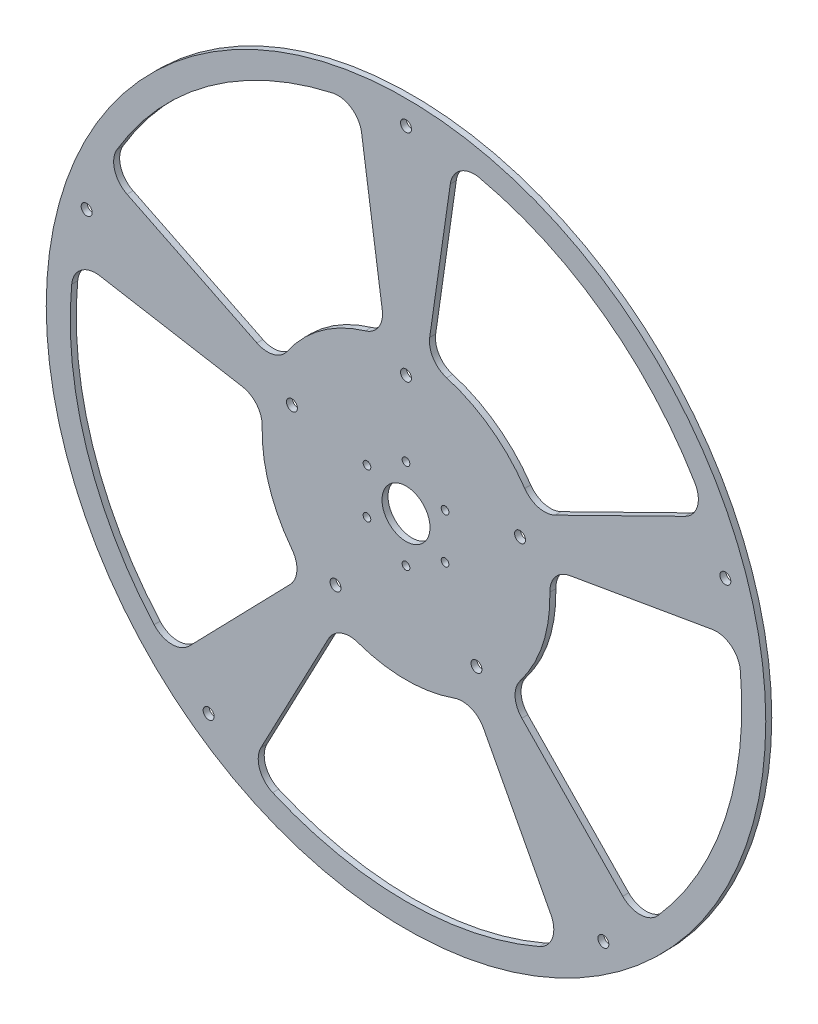
from build123d import *

# Parameters (mm, degrees)
SKETCH1_R           = 190.5
SKETCH1_R_2         = 12.7
SKETCH1_R_3         = 2.9
SKETCH1_R_4         = 2.032
BOSS_EXTRUDE3_DEPTH = 3.175
FILLET1_R           = 12.7
FILLET2_R           = 12.7
FILLET3_R           = 12.7


with BuildPart() as part:
    # Sketch1 → Boss-Extrude3 (new body)
    with BuildSketch(Plane.XY):
        Circle(SKETCH1_R)
        Circle(SKETCH1_R_2, mode=Mode.SUBTRACT)
        with Locations((-37.324363521, -51.372579143)):
            Circle(SKETCH1_R_3, mode=Mode.SUBTRACT)
        with Locations((-169.097848597, 54.9432216)):
            Circle(SKETCH1_R_3, mode=Mode.SUBTRACT)
        with Locations((0, 177.8)):
            Circle(SKETCH1_R_3, mode=Mode.SUBTRACT)
        with Locations((169.097848597, 54.9432216)):
            Circle(SKETCH1_R_3, mode=Mode.SUBTRACT)
        with Locations((104.508217858, -143.8432216)):
            Circle(SKETCH1_R_3, mode=Mode.SUBTRACT)
        with Locations((-104.508217858, -143.8432216)):
            Circle(SKETCH1_R_3, mode=Mode.SUBTRACT)
        with Locations((-20.677222541, 11.938)):
            Circle(SKETCH1_R_4, mode=Mode.SUBTRACT)
        with Locations((0, 23.876)):
            Circle(SKETCH1_R_4, mode=Mode.SUBTRACT)
        with Locations((20.677222541, 11.938)):
            Circle(SKETCH1_R_4, mode=Mode.SUBTRACT)
        with Locations((20.677222541, -11.938)):
            Circle(SKETCH1_R_4, mode=Mode.SUBTRACT)
        with Locations((0, -23.876)):
            Circle(SKETCH1_R_4, mode=Mode.SUBTRACT)
        with Locations((-20.677222541, -11.938)):
            Circle(SKETCH1_R_4, mode=Mode.SUBTRACT)
        with Locations((-60.392088785, 19.622579143)):
            Circle(SKETCH1_R_3, mode=Mode.SUBTRACT)
        with Locations((0, 63.5)):
            Circle(SKETCH1_R_3, mode=Mode.SUBTRACT)
        with Locations((60.392088785, 19.622579143)):
            Circle(SKETCH1_R_3, mode=Mode.SUBTRACT)
        with Locations((37.324363521, -51.372579143)):
            Circle(SKETCH1_R_3, mode=Mode.SUBTRACT)
        with BuildLine():
            Line((25.335121222, 175.985714286), (10.857909095, 75.42244898))
            ThreePointArc((10.857909095, 75.42244898), (44.789236225, 61.647094971), (68.375733143, 33.63330369))
            Line((68.375733143, 33.63330369), (159.543377334, 78.477708611))
            ThreePointArc((159.543377334, 78.477708611), (104.508217858, 143.8432216), (25.335121222, 175.985714286))
        make_face(mode=Mode.SUBTRACT)
        with BuildLine():
            Line((-25.4, 175.976362049), (-10.885714286, 75.418440878))
            ThreePointArc((-10.885714286, 75.418440878), (-44.800599154, 61.63883772), (-68.375733143, 33.63330369))
            Line((-68.375733143, 33.63330369), (-159.543377334, 78.477708611))
            ThreePointArc((-159.543377334, 78.477708611), (-104.53473136, 143.823954679), (-25.4, 175.976362049))
        make_face(mode=Mode.SUBTRACT)
        with BuildLine():
            Line((75.086290011, 12.980333294), (175.201343359, 30.287444352))
            ThreePointArc((175.201343359, 30.287444352), (169.097848597, -54.9432216), (123.938351095, -127.483823005))
            Line((123.938351095, -127.483823005), (53.116436183, -54.635924145))
            ThreePointArc((53.116436183, -54.635924145), (72.470506542, -23.547094971), (75.086290011, 12.980333294))
        make_face(mode=Mode.SUBTRACT)
        with BuildLine():
            Line((35.547970221, -67.400161819), (82.945263848, -157.267044244))
            ThreePointArc((82.945263848, -157.267044244), (0, -177.8), (-82.945263848, -157.267044244))
            Line((-82.945263848, -157.267044244), (-35.547970221, -67.400161819))
            ThreePointArc((-35.547970221, -67.400161819), (0, -76.2), (35.547970221, -67.400161819))
        make_face(mode=Mode.SUBTRACT)
        with BuildLine():
            Line((-175.201343359, 30.287444352), (-75.086290011, 12.980333294))
            ThreePointArc((-75.086290011, 12.980333294), (-72.470506542, -23.547094971), (-53.116436183, -54.635924145))
            Line((-53.116436183, -54.635924145), (-123.938351095, -127.483823005))
            ThreePointArc((-123.938351095, -127.483823005), (-169.097848597, -54.9432216), (-175.201343359, 30.287444352))
        make_face(mode=Mode.SUBTRACT)
    extrude(amount=BOSS_EXTRUDE3_DEPTH)

    # Fillet1
    fillet1_edges = [part.edges().sort_by_distance(p)[0] for p in [
        (-175.201343359, 30.287444352, 1.5875),
    ]]
    fillet(fillet1_edges, radius=FILLET1_R)

    # Fillet2
    fillet2_edges = [part.edges().sort_by_distance(p)[0] for p in [
        (35.547970221, -67.400161819, 1.5875),
        (123.938351095, -127.483823005, 1.5875),
        (53.116436183, -54.635924145, 1.5875),
        (75.086290011, 12.980333294, 1.5875),
        (175.201343359, 30.287444352, 1.5875),
        (68.375733143, 33.63330369, 1.5875),
        (159.543377334, 78.477708611, 1.5875),
        (25.335121222, 175.985714286, 1.5875),
        (10.857909095, 75.42244898, 1.5875),
        (-10.885714286, 75.418440878, 1.5875),
        (-68.375733143, 33.63330369, 1.5875),
        (-25.4, 175.976362049, 1.5875),
        (-159.543377334, 78.477708611, 1.5875),
    ]]
    fillet(fillet2_edges, radius=FILLET2_R)

    # Fillet3
    fillet3_edges = [part.edges().sort_by_distance(p)[0] for p in [
        (-75.086290011, 12.980333294, 1.5875),
        (-123.938351095, -127.483823005, 1.5875),
        (-53.116436183, -54.635924145, 1.5875),
        (82.945263848, -157.267044244, 1.5875),
        (-82.945263848, -157.267044244, 1.5875),
        (-35.547970221, -67.400161819, 1.5875),
    ]]
    fillet(fillet3_edges, radius=FILLET3_R)


solid = part.part
